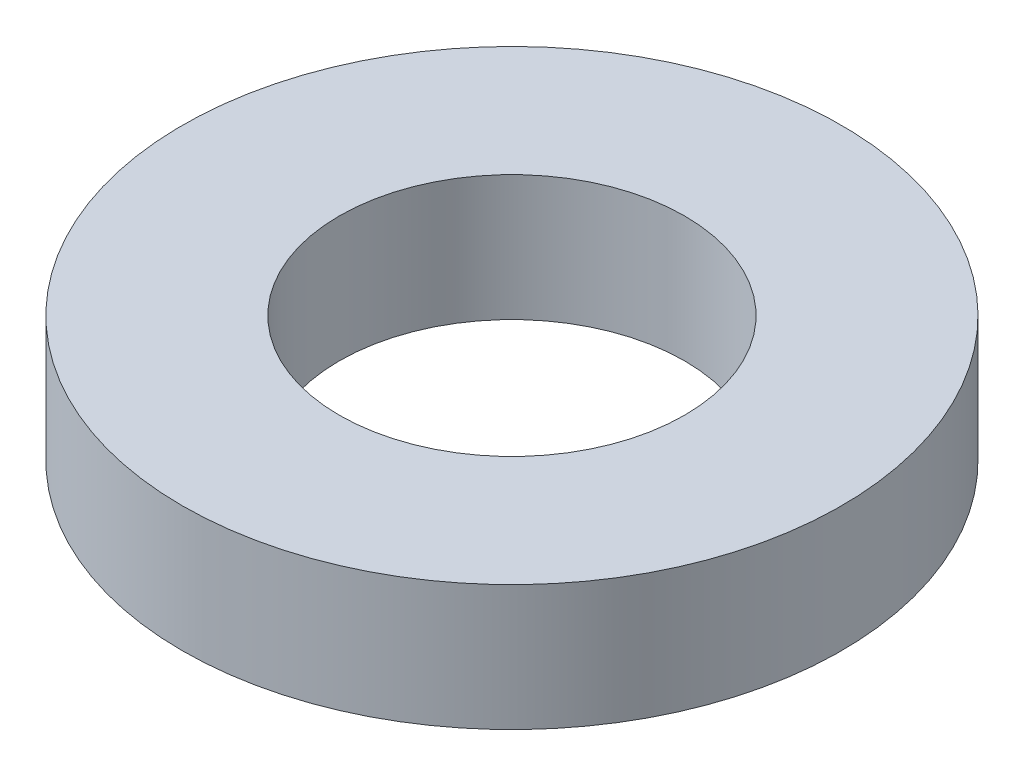
from build123d import *

# Parameters (mm, degrees)
SKETCH1_R           = 52.5
BOSS_EXTRUDE1_DEPTH = 20
SKETCH2_R           = 27.5
CUT_EXTRUDE1_DEPTH  = 77.892782496


with BuildPart() as part:
    # Sketch1 → Boss-Extrude1 (new body)
    with BuildSketch(Plane(origin=(0, 0, 0), x_dir=(1, 0, 0), z_dir=(0, 1, 0))):
        Circle(SKETCH1_R)
    extrude(amount=BOSS_EXTRUDE1_DEPTH)

    # Sketch2 → Cut-Extrude1 (cut, through all)
    with BuildSketch(Plane(origin=(0, 0, 0), x_dir=(1, 0, 0), z_dir=(0, 1, 0))):
        Circle(SKETCH2_R)
    extrude(amount=CUT_EXTRUDE1_DEPTH, mode=Mode.SUBTRACT)


solid = part.part
